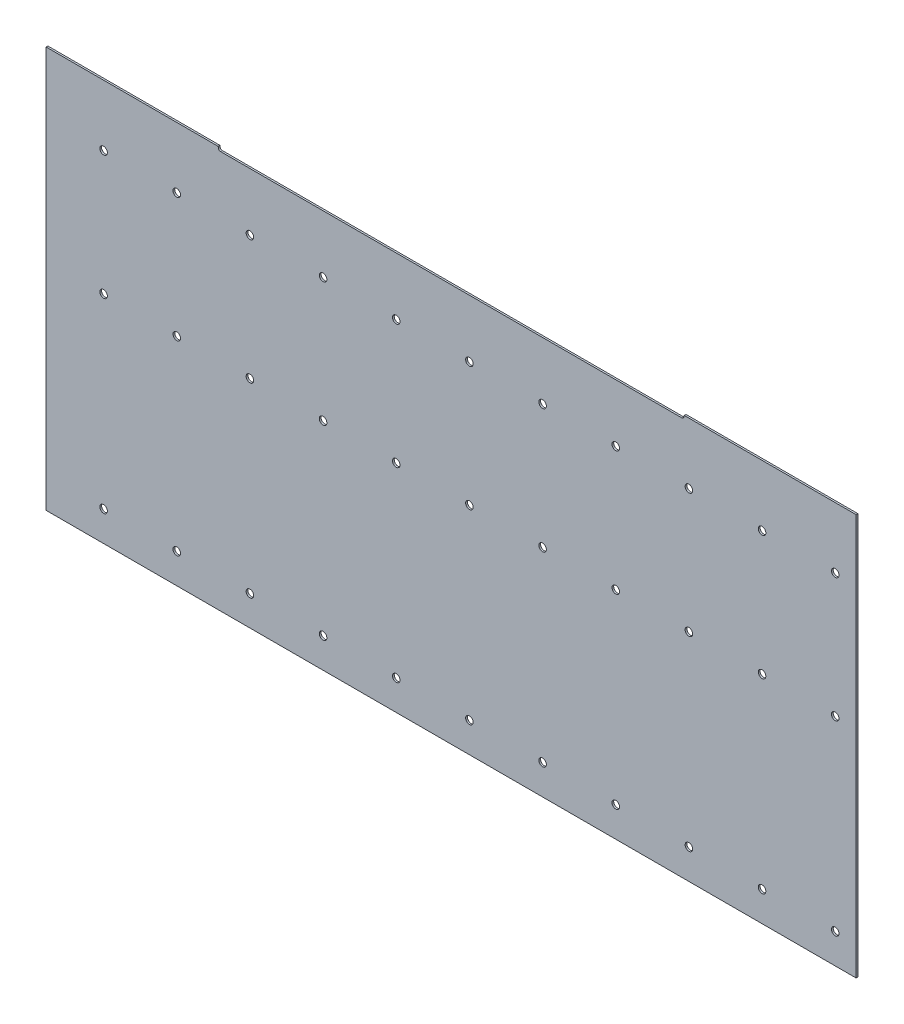
from build123d import *

# Parameters (mm, degrees)
ESQUISSE1_W                = 365.3
ESQUISSE1_H                = 182
BOSS_EXTRU_1_DEPTH         = 0.396875
ESQUISSE2_R                = 1.7
ENL_V_MAT_EXTRU_1_DEPTH    = 10
R_P_TITION_LIN_AIRE1_COUNT = 11
R_P_TITION_LIN_AIRE1_PITCH = 33
ESQUISSE3_W                = 210
ESQUISSE3_H                = 2
ENL_V_MAT_EXTRU_2_DEPTH    = 205.065314395
CONG_1_R                   = 1
ESQUISSE4_OUTSIDE_W        = 448.926
ESQUISSE4_OUTSIDE_H        = 265.626
ESQUISSE4_OUTSIDE_W_2      = 365.3
ESQUISSE4_OUTSIDE_H_2      = 181
ENL_V_MAT_EXTRU_3_DEPTH    = 205.065314395


with BuildPart() as part:
    # Esquisse1 → Boss.-Extru.1 (new, symmetric)
    with BuildSketch(Plane.XY):
        Rectangle(ESQUISSE1_W, ESQUISSE1_H)
    extrude(amount=BOSS_EXTRU_1_DEPTH, both=True)

    # Esquisse2 → Enlèv. mat.-Extru.1 (cut)
    with BuildSketch(Plane.XY.offset(0.396875)):
        with Locations((-156.75, 63)):
            Circle(ESQUISSE2_R)
        with Locations((-156.75, 7)):
            Circle(ESQUISSE2_R)
        with Locations((-156.75, -77)):
            Circle(ESQUISSE2_R)
    enl_v_mat_extru_1 = extrude(amount=-ENL_V_MAT_EXTRU_1_DEPTH, mode=Mode.SUBTRACT)

    # Répétition linéaire1: Enlèv. mat.-Extru.1 ×11
    with Locations(*[(i * R_P_TITION_LIN_AIRE1_PITCH, 0, 0) for i in range(1, R_P_TITION_LIN_AIRE1_COUNT)]):
        add(enl_v_mat_extru_1, mode=Mode.SUBTRACT)

    # Esquisse3 → Enlèv. mat.-Extru.2 (cut, through all)
    with BuildSketch(Plane.XY.offset(0.396875)):
        with Locations((0, 90)):
            Rectangle(ESQUISSE3_W, ESQUISSE3_H)
    extrude(amount=-ENL_V_MAT_EXTRU_2_DEPTH, mode=Mode.SUBTRACT)

    # Congé1
    cong_1_edges = [part.edges().sort_by_distance(p)[0] for p in [
        (105, 89, 0),
        (-105, 89, 0),
    ]]
    fillet(cong_1_edges, radius=CONG_1_R)
    cong_1_2_edges = [part.edges().sort_by_distance(p)[0] for p in [
        (105, 91, 0),
        (-105, 91, 0),
    ]]
    fillet(cong_1_2_edges, radius=CONG_1_R - 0.0001)  # a hair under: the kernel refuses the full size

    # Esquisse4 outside → Enlèv. mat.-Extru.3 (cut, through all)
    with BuildSketch(Plane.XY.offset(0.396875)):
        Rectangle(ESQUISSE4_OUTSIDE_W, ESQUISSE4_OUTSIDE_H)
        Rectangle(ESQUISSE4_OUTSIDE_W_2, ESQUISSE4_OUTSIDE_H_2, mode=Mode.SUBTRACT)
    extrude(amount=-ENL_V_MAT_EXTRU_3_DEPTH, mode=Mode.SUBTRACT)


solid = part.part
